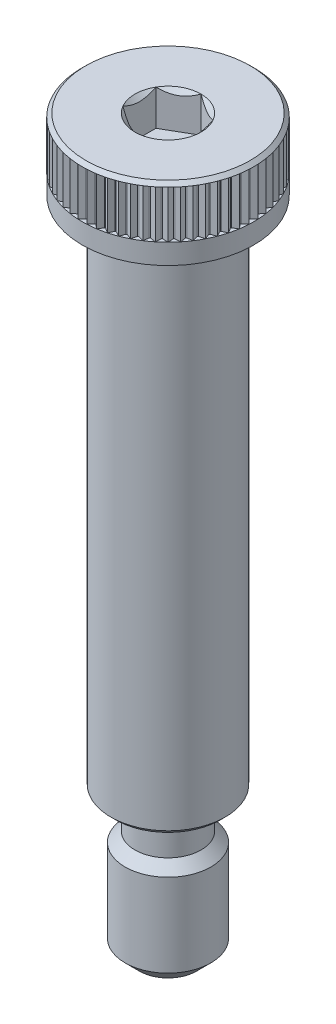
from build123d import *

# Parameters (mm, degrees)
SKETCH1_R          = 9.525
EXTRUDE1_DEPTH     = 7.9375
CUT_EXTRUDE1_DEPTH = 3.96875
SKETCH18_R         = 3.666174209
CUT_EXTRUDE4_DEPTH = 1.322916667
CUT_EXTRUDE4_DRAFT = -45
SKETCH4_R          = 6.35
EXTRUDE2_DEPTH     = 57.15
SKETCH5_R          = 4.7625
EXTRUDE3_DEPTH     = 15.875
CHAMFER1_SIZE      = 1.5875
CHAMFER2_SIZE      = 0.529166667
CUT_EXTRUDE3_DEPTH = 5.291666667
CIRPATTERN2_COUNT  = 60
CHAMFER3_SIZE      = 0.396875


with BuildPart() as part:
    # Sketch1 → Extrude1 (new body)
    with BuildSketch(Plane(origin=(0, 0, 0), x_dir=(1, 0, 0), z_dir=(0, 1, 0))):
        with Locations(Location((0, 0, 0), (0, 0, 270))):
            Circle(SKETCH1_R)
    extrude(amount=EXTRUDE1_DEPTH)

    # Sketch2 → Cut-Extrude1 (cut)
    with BuildSketch(Plane(origin=(0, 7.9375, 0), x_dir=(-1, 0, 0), z_dir=(0, 1, 0))):
        Polygon((0, -3.666174209), (3.175, -1.833087105), (3.175, 1.833087105), (0, 3.666174209), (-3.175, 1.833087105), (-3.175, -1.833087105), align=None)
    extrude(amount=-CUT_EXTRUDE1_DEPTH, mode=Mode.SUBTRACT)


with BuildPart() as cut_extrude4_tool:
    # Sketch18 → Cut-Extrude4 (with draft: the straight prism first)
    with BuildSketch(Plane(origin=(0, 7.9375, 0), x_dir=(1, 0, 0), z_dir=(0, 1, 0))):
        Circle(SKETCH18_R)
    extrude(amount=-CUT_EXTRUDE4_DEPTH)
    # Cut-Extrude4: the draft: its side faces are tilted about the plane it starts from
    cut_extrude4_sides = [cut_extrude4_tool.faces().sort_by_distance(p)[0] for p in [
        (-3.666174209, 7.276041667, 0),
    ]]
    draft(cut_extrude4_sides, Plane(origin=(0, 7.9375, 0), x_dir=(1, 0, 0), z_dir=(0, 1, 0)), CUT_EXTRUDE4_DRAFT)


with BuildPart() as part_1:
    add(part.part)

    # Cut-Extrude4: cut by cut_extrude4_tool
    add(cut_extrude4_tool.part, mode=Mode.SUBTRACT)

    # Sketch4 → Extrude2 (add)
    with BuildSketch(Plane.XZ.offset(57.15)):
        with Locations(Location((0, 0, 0), (0, 0, 270))):
            Circle(SKETCH4_R)
    extrude(amount=-EXTRUDE2_DEPTH)

    # Sketch5 → Extrude3 (add)
    with BuildSketch(Plane.XZ.offset(57.15)):
        with Locations(Location((0, 0, 0), (0, 0, 270))):
            Circle(SKETCH5_R)
    extrude(amount=EXTRUDE3_DEPTH)

    # Chamfer1
    chamfer1_edges = [part_1.edges().sort_by_distance(p)[0] for p in [
        (0, -73.025, 4.7625),
    ]]
    chamfer(chamfer1_edges, length=CHAMFER1_SIZE)

    # Sketch17 → Cut-Revolve1 (revolve, cut)
    with BuildSketch(Plane.XY, mode=Mode.PRIVATE) as cut_revolve1_sk:
        with BuildLine():
            Line((4.862800608, -57.15), (6.35, -57.15))
            Line((6.35, -57.15), (6.35, -61.11875))
            Line((6.35, -61.11875), (6.35, -63.796574392))
            Line((6.35, -63.796574392), (3.672175608, -61.11875))
            Line((3.672175608, -61.11875), (3.672175608, -58.340625))
            ThreePointArc((3.672175608, -58.340625), (4.020901597, -57.498725989), (4.862800608, -57.15))
        make_face()
    revolve(cut_revolve1_sk.sketch.rotate(Axis((0, 0, 0), (0, -1, 0)), 90), axis=Axis((0, 0, 0), (0, -1, 0)), mode=Mode.SUBTRACT)

    # Chamfer2
    chamfer2_edges = [part_1.edges().sort_by_distance(p)[0] for p in [
        (0, -57.15, 6.35),
    ]]
    chamfer(chamfer2_edges, length=CHAMFER2_SIZE)

    # Sketch10 → Cut-Extrude3 (cut)
    with BuildSketch(Plane(origin=(0, 7.540625, 0), x_dir=(-1, 0, 0), z_dir=(0, 1, 0))):
        with BuildLine():
            Line((-9.511946319, -0.498499983), (-9.651402034, -0.505808548))
            Line((-9.651402034, -0.505808548), (-9.651402034, 0.505808548))
            Line((-9.651402034, 0.505808548), (-9.511946319, 0.498499983))
            Line((-9.511946319, 0.498499983), (-9.075025254, 0.061578918))
            ThreePointArc((-9.075025254, 0.061578918), (-9.049518431, 0), (-9.075025254, -0.061578918))
            Line((-9.075025254, -0.061578918), (-9.511946319, -0.498499983))
        make_face()
    cut_extrude3 = extrude(amount=-CUT_EXTRUDE3_DEPTH, mode=Mode.SUBTRACT)

    # CirPattern2: Cut-Extrude3 ×60 about axis
    cirpattern2_axis = Axis((0, 0, 0), (0, 1, 0))
    for i in range(1, CIRPATTERN2_COUNT):
        add(cut_extrude3.rotate(cirpattern2_axis, i * 360 / CIRPATTERN2_COUNT), mode=Mode.SUBTRACT)

    # Chamfer3
    chamfer3_edges = [part_1.edges().sort_by_distance(p)[0] for p in [
        (0, 7.9375, -9.525),
    ]]
    chamfer(chamfer3_edges, length=CHAMFER3_SIZE - 0.0001)  # a hair under: the kernel refuses the full size


solid = part_1.part
